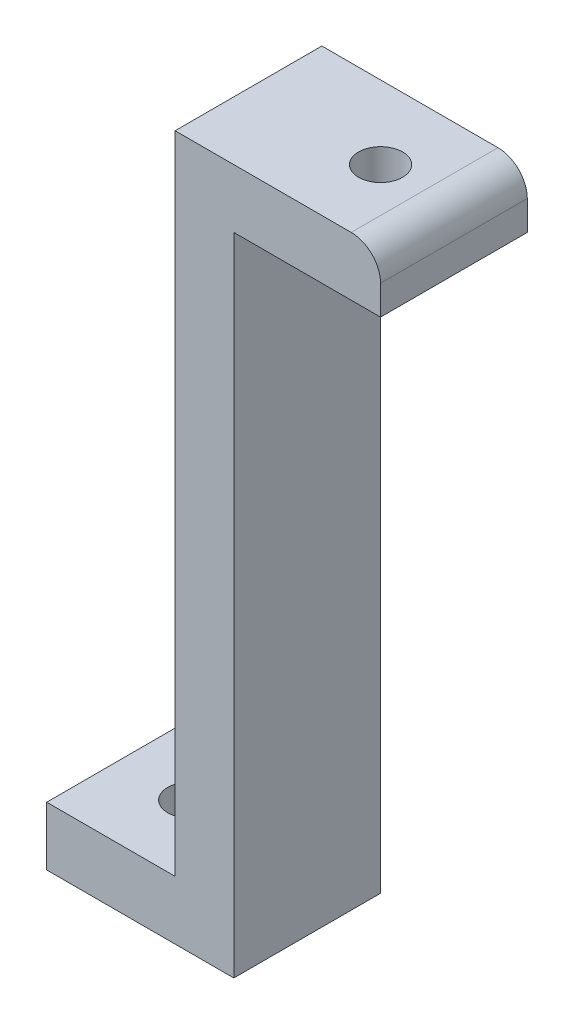
from build123d import *

# Parameters (mm, degrees)
BOSS_EXTRUDE1_DEPTH = 10
SKETCH2_R           = 1.5
CUT_EXTRUDE1_DEPTH  = 10
SKETCH3_R           = 1.5
CUT_EXTRUDE2_DEPTH  = 10
FILLET1_R           = 2


with BuildPart() as part:
    # Sketch1 → Boss-Extrude1 (new body)
    with BuildSketch(Plane.XY):
        Polygon((0, 0), (-14, 0), (-14, -44), (-22.75, -44), (-22.75, -48), (-10, -48), (-10, -4), (0, -4), align=None)
    extrude(amount=BOSS_EXTRUDE1_DEPTH)

    # Sketch2 → Cut-Extrude1 (cut)
    with BuildSketch(Plane(origin=(0, -44, 0), x_dir=(1, 0, 0), z_dir=(0, 1, 0))):
        with Locations((-18, -5)):
            Circle(SKETCH2_R)
    extrude(amount=-CUT_EXTRUDE1_DEPTH, mode=Mode.SUBTRACT)

    # Sketch3 → Cut-Extrude2 (cut)
    with BuildSketch(Plane(origin=(0, -4, 0), x_dir=(-1, 0, 0), z_dir=(0, -1, 0))):
        with Locations((5, -5)):
            Circle(SKETCH3_R)
    extrude(amount=-CUT_EXTRUDE2_DEPTH, mode=Mode.SUBTRACT)

    # Fillet1
    fillet1_edges = [part.edges().sort_by_distance(p)[0] for p in [
        (0, 0, 5),
    ]]
    fillet(fillet1_edges, radius=FILLET1_R)


solid = part.part
